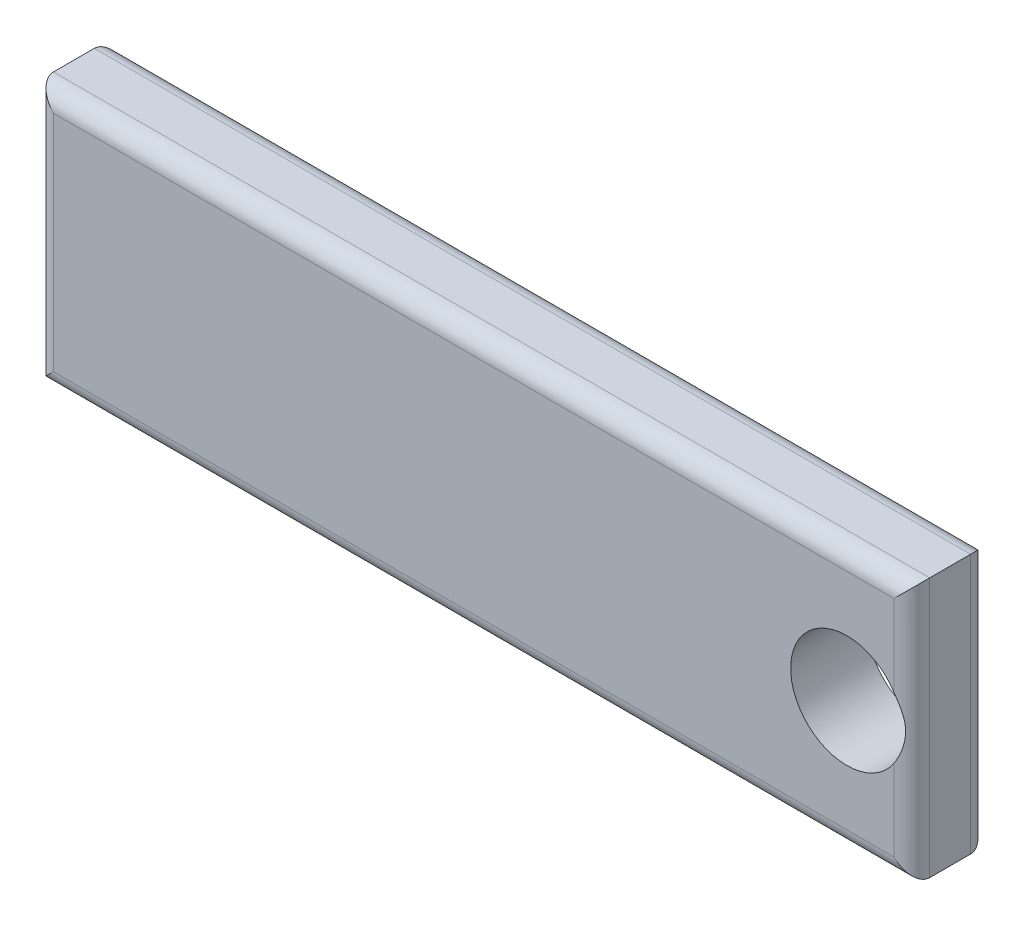
from build123d import *

# Parameters (mm, degrees)
SKETCH1_W           = 34.29
SKETCH1_H           = 10.16
SKETCH1_R           = 2.2
BOSS_EXTRUDE1_DEPTH = 3
FILLET1_R           = 0.7


with BuildPart() as part:
    # Sketch1 → Boss-Extrude1 (new body)
    with BuildSketch(Plane.XY):
        with Locations((17.145, 5.08)):
            Rectangle(SKETCH1_W, SKETCH1_H)
        with Locations((31.75, 5.08)):
            Circle(SKETCH1_R, mode=Mode.SUBTRACT)
    extrude(amount=BOSS_EXTRUDE1_DEPTH)

    # Fillet1
    # the kernel refuses this fillet: 0.7 mm, written as the material it takes off along each edge
    with BuildSketch(Plane(origin=(34.29, 11.91, 3), x_dir=(0, 0, -1), z_dir=(0, -1, 0)), Plane(origin=(0, -1.75, 3), x_dir=(0, 0, -1), z_dir=(0, 1, 0))) as fillet1_piece_1:
        with BuildLine():
            CenterArc((FILLET1_R, -FILLET1_R), FILLET1_R, 90, 90)
            Line((0, -FILLET1_R), (0, 0))
            Line((0, 0), (FILLET1_R, 0))
        make_face()
    extrude(amount=13.66, mode=Mode.SUBTRACT)
    with BuildSketch(Plane(origin=(-1.75, 10.16, 3), x_dir=(0, 0, -1), z_dir=(1, 0, 0)), Plane(origin=(36.04, 0, 3), x_dir=(0, 0, -1), z_dir=(-1, 0, 0))) as fillet1_piece_2:
        with BuildLine():
            CenterArc((FILLET1_R, -FILLET1_R), FILLET1_R, 90, 90)
            Line((0, -FILLET1_R), (0, 0))
            Line((0, 0), (FILLET1_R, 0))
        make_face()
    extrude(amount=37.79, mode=Mode.SUBTRACT)
    with BuildSketch(Plane(origin=(-1.75, 10.16, 0), x_dir=(0, 0, 1), z_dir=(1, 0, 0)), Plane(origin=(36.04, 0, 0), x_dir=(0, 0, 1), z_dir=(-1, 0, 0))) as fillet1_piece_3:
        with BuildLine():
            CenterArc((FILLET1_R, FILLET1_R), FILLET1_R, 180, 90)
            Line((0, FILLET1_R), (0, 0))
            Line((0, 0), (FILLET1_R, 0))
        make_face()
    extrude(amount=37.79, mode=Mode.SUBTRACT)
    with BuildSketch(Plane(origin=(34.29, 11.91, 0), x_dir=(0, 0, 1), z_dir=(0, -1, 0)), Plane(origin=(0, -1.75, 0), x_dir=(0, 0, 1), z_dir=(0, 1, 0))) as fillet1_piece_4:
        with BuildLine():
            CenterArc((FILLET1_R, FILLET1_R), FILLET1_R, 180, 90)
            Line((0, FILLET1_R), (0, 0))
            Line((0, 0), (FILLET1_R, 0))
        make_face()
    extrude(amount=13.66, mode=Mode.SUBTRACT)


solid = part.part
